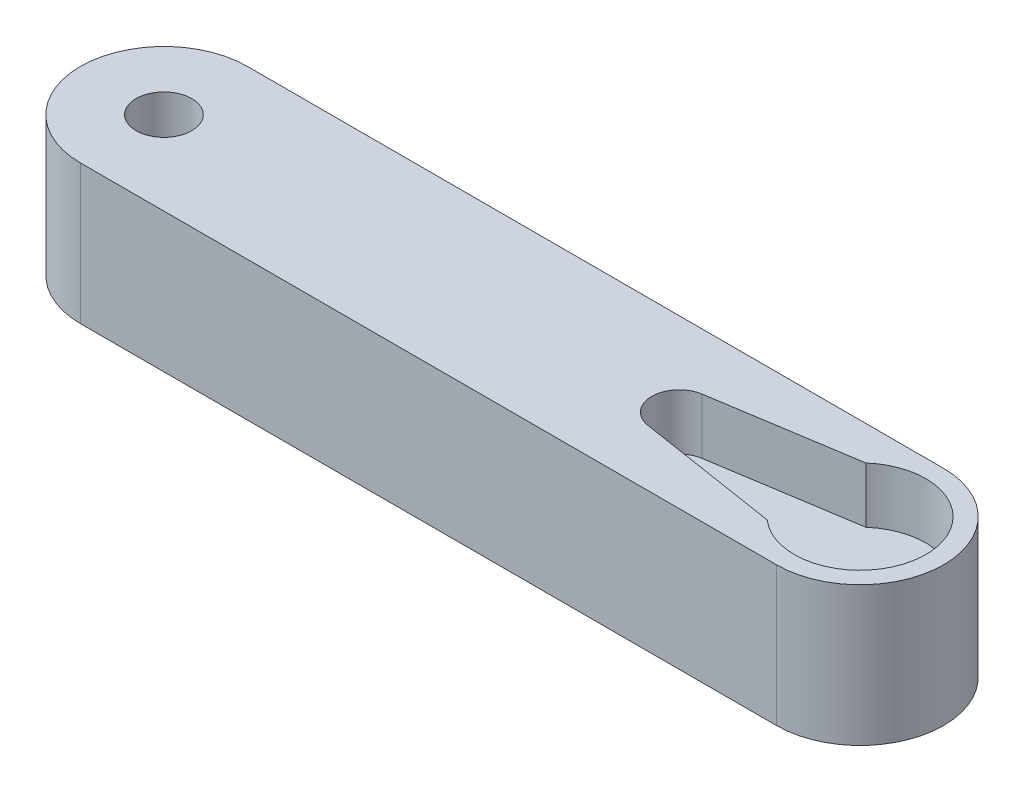
from build123d import *

# Parameters (mm, degrees)
BOSS_EXTRUDE1_DEPTH = 12.7
SKETCH4_R           = 2.54
CUT_EXTRUDE3_DEPTH  = 43.063657711
CUT_EXTRUDE4_DEPTH  = 5.08


with BuildPart() as part:
    # Sketch3 → Boss-Extrude1 (new body)
    with BuildSketch(Plane(origin=(0, 0, 0), x_dir=(1, 0, 0), z_dir=(0, 1, 0))):
        with BuildLine():
            Line((-31.75, 7.62), (31.75, 7.62))
            ThreePointArc((31.75, 7.62), (39.37, 0), (31.75, -7.62))
            Line((31.75, -7.62), (-31.75, -7.62))
            ThreePointArc((-31.75, -7.62), (-39.37, 0), (-31.75, 7.62))
        make_face()
    extrude(amount=BOSS_EXTRUDE1_DEPTH)

    # Sketch4 → Cut-Extrude3 (cut, through all)
    with BuildSketch(Plane(origin=(0, 12.7, 0), x_dir=(1, 0, 0), z_dir=(0, 1, 0))):
        with Locations((-31.75, 0)):
            Circle(SKETCH4_R)
    extrude(amount=-CUT_EXTRUDE3_DEPTH, mode=Mode.SUBTRACT)

    # Sketch5 → Cut-Extrude4 (cut)
    with BuildSketch(Plane(origin=(0, 12.7, 0), x_dir=(1, 0, 0), z_dir=(0, 1, 0))):
        with BuildLine():
            Line((14.861876683, -2.469691065), (27.78137089, -4.50000243))
            ThreePointArc((27.78137089, -4.50000243), (37.75000324, 0), (27.78137089, 4.50000243))
            Line((27.78137089, 4.50000243), (14.861876683, 2.469691065))
            ThreePointArc((14.861876683, 2.469691065), (12.74998974, 0), (14.861876683, -2.469691065))
        make_face()
    extrude(amount=-CUT_EXTRUDE4_DEPTH, mode=Mode.SUBTRACT)


solid = part.part
